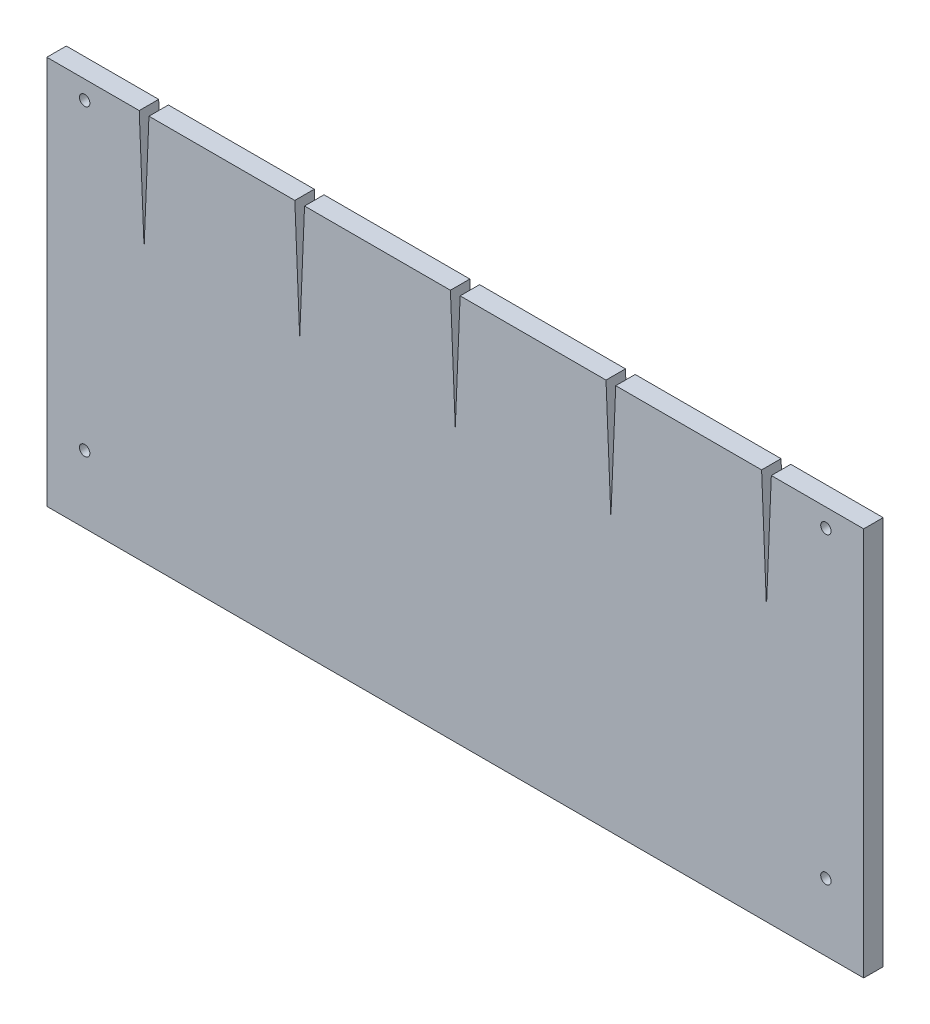
from build123d import *

# Parameters (mm, degrees)
SKETCH1_W            = 266.7
SKETCH1_H            = 127
BOSS_EXTRUDE1_DEPTH  = 6.35
M3_CLEARANCE_HOLE1_D = 3.4
CUT_EXTRUDE3_DEPTH   = 296.462709153
LPATTERN1_COUNT      = 5
LPATTERN1_PITCH      = 50.8


with BuildPart() as part:
    # Sketch1 → Boss-Extrude1 (new body)
    with BuildSketch(Plane.XY):
        with Locations((133.35, 63.5)):
            Rectangle(SKETCH1_W, SKETCH1_H)
    extrude(amount=BOSS_EXTRUDE1_DEPTH)

    # M3 Clearance Hole1 (through all)
    with Locations(Plane.XY.offset(6.35)):
        with Locations((12.3444, 121.0056), (12.3444, 21.9964), (254.3556, 21.9964), (254.3556, 121.0056)):
            Hole(M3_CLEARANCE_HOLE1_D / 2)

    # Sketch6 → Cut-Extrude3 (cut, through all)
    with BuildSketch(Plane.XY.offset(6.35)):
        Polygon((30.1625, 127), (31.75, 88.9), (33.3375, 127), align=None)
    cut_extrude3 = extrude(amount=-CUT_EXTRUDE3_DEPTH, mode=Mode.SUBTRACT)

    # LPattern1: Cut-Extrude3 ×5
    with Locations(*[(i * LPATTERN1_PITCH, 0, 0) for i in range(1, LPATTERN1_COUNT)]):
        add(cut_extrude3, mode=Mode.SUBTRACT)


solid = part.part
